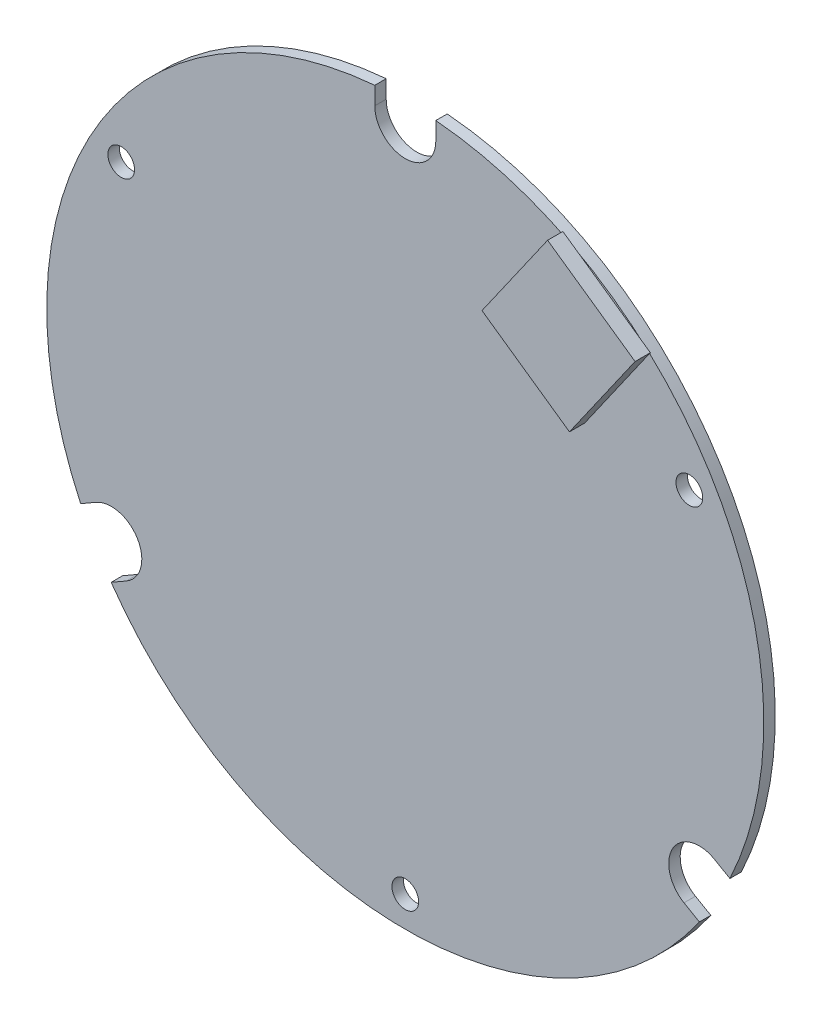
from build123d import *

# Parameters (mm, degrees)
SALIENTE_EXTRUIR1_DEPTH = 1.5
CROQUIS2_R              = 1.75
CORTAR_EXTRUIR1_DEPTH   = 1.5
SALIENTE_EXTRUIR2_START = 2
SALIENTE_EXTRUIR2_DEPTH = 2


with BuildPart() as part:
    # Croquis1 → Saliente-Extruir1 (new body)
    with BuildSketch(Plane.XY):
        with BuildLine():
            ThreePointArc((1, 40.627016654), (-2.449489743, 41.33772234), (-4, 44.5))
            Line((-4, 44.5), (-4, 46.829477896))
            ThreePointArc((-4, 46.829477896), (-40.703193978, 23.5), (-42.555517504, -19.950637333))
            Line((-42.555517504, -19.950637333), (-40.538130468, -18.785898385))
            ThreePointArc((-40.538130468, -18.785898385), (-35.074028853, -20.25), (-36.538130468, -25.714101615))
            Line((-36.538130468, -25.714101615), (-38.555517504, -26.878840563))
            ThreePointArc((-38.555517504, -26.878840563), (0, -47), (38.555517504, -26.878840563))
            Line((38.555517504, -26.878840563), (36.538130468, -25.714101615))
            ThreePointArc((36.538130468, -25.714101615), (35.074028853, -20.25), (40.538130468, -18.785898385))
            Line((40.538130468, -18.785898385), (42.555517504, -19.950637333))
            ThreePointArc((42.555517504, -19.950637333), (40.703193978, 23.5), (4, 46.829477896))
            Line((4, 46.829477896), (4, 44.5))
            ThreePointArc((4, 44.5), (3.16227766, 42.050510257), (1, 40.627016654))
        make_face()
    extrude(amount=SALIENTE_EXTRUIR1_DEPTH)

    # Croquis2 → Cortar-Extruir1 (cut)
    with BuildSketch(Plane.XY.offset(1.5)):
        with Locations((-37.239092363, 21.5)):
            Circle(CROQUIS2_R)
        with Locations((37.239092363, 21.5)):
            Circle(CROQUIS2_R)
        with Locations((0, -43)):
            Circle(CROQUIS2_R)
    extrude(amount=-CORTAR_EXTRUIR1_DEPTH, mode=Mode.SUBTRACT)


with BuildPart() as body_2:
    # Croquis3 → Saliente-Extruir2 (new body)
    with BuildSketch(Plane.XY.offset(1.5).offset(SALIENTE_EXTRUIR2_START)):
        Polygon((22.657969289, 44.563061247), (34.126097909, 36.532991138), (25.522451364, 24.245710474), (14.054322744, 32.275780582), align=None)
    extrude(amount=SALIENTE_EXTRUIR2_DEPTH)


solid = Compound([part.part, body_2.part])
